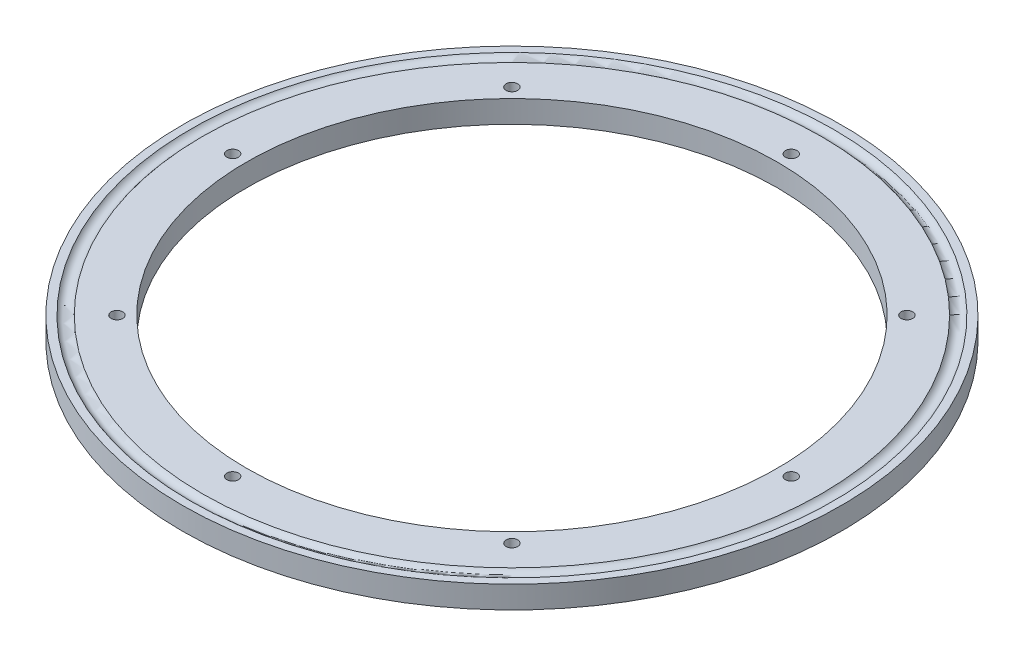
from build123d import *

# Parameters (mm, degrees)
SKETCH1_R           = 74.93
SKETCH1_R_2         = 1.3208
SKETCH1_R_3         = 60.325
BOSS_EXTRUDE1_DEPTH = 5.08


with BuildPart() as part:
    # Sketch1 → Boss-Extrude1 (new body)
    with BuildSketch(Plane(origin=(0, 0, 0), x_dir=(1, 0, 0), z_dir=(0, 1, 0))):
        Circle(SKETCH1_R)
        with Locations((44.901280605, 44.901280605)):
            Circle(SKETCH1_R_2, mode=Mode.SUBTRACT)
        with Locations((-44.901280605, -44.901280605)):
            Circle(SKETCH1_R_2, mode=Mode.SUBTRACT)
        with Locations((0, -63.5)):
            Circle(SKETCH1_R_2, mode=Mode.SUBTRACT)
        with Locations((44.901280605, -44.901280605)):
            Circle(SKETCH1_R_2, mode=Mode.SUBTRACT)
        with Locations((63.5, 0)):
            Circle(SKETCH1_R_2, mode=Mode.SUBTRACT)
        with Locations((-63.5, 0)):
            Circle(SKETCH1_R_2, mode=Mode.SUBTRACT)
        with Locations((-44.901280605, 44.901280605)):
            Circle(SKETCH1_R_2, mode=Mode.SUBTRACT)
        Circle(SKETCH1_R_3, mode=Mode.SUBTRACT)
        with Locations((0, 63.5)):
            Circle(SKETCH1_R_2, mode=Mode.SUBTRACT)
    extrude(amount=BOSS_EXTRUDE1_DEPTH)

    # Sketch2 → Cut-Revolve1 (revolve, cut)
    with BuildSketch(Plane(origin=(0, 0, 0), x_dir=(0, 0, -1), z_dir=(1, 0, 0))):
        with BuildLine():
            ThreePointArc((73.146215296, 0), (71.755, 0.762), (70.363784704, 0))
            Line((70.363784704, 0), (73.146215296, 0))
        make_face()
        with BuildLine():
            ThreePointArc((70.363784704, 5.08), (71.755, 4.318), (73.146215296, 5.08))
            Line((73.146215296, 5.08), (70.363784704, 5.08))
        make_face()
    revolve(axis=Axis((0, 0, 0), (0, 1, 0)), mode=Mode.SUBTRACT)


solid = part.part
